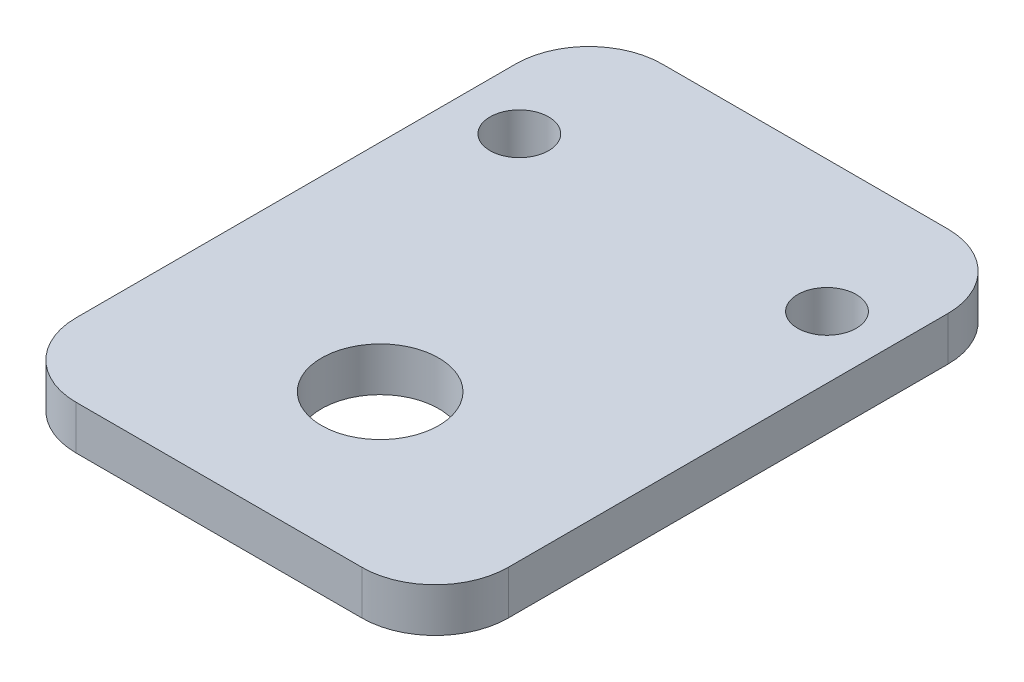
from build123d import *

# Parameters (mm, degrees)
ESQUISSE1_W             = 29.5
ESQUISSE1_H             = 3
EXTRU_MINCE1_DEPTH      = 40
ESQUISSE2_R             = 2
ESQUISSE2_R_2           = 4
ENL_V_MAT_EXTRU_1_DEPTH = 50.792067641
CONG_1_R                = 5


with BuildPart() as part:
    # Esquisse1 → Extru.-Mince1 (new body)
    with BuildSketch(Plane.XY):
        with Locations((14.75, 1.5)):
            Rectangle(ESQUISSE1_W, ESQUISSE1_H)
    extrude(amount=EXTRU_MINCE1_DEPTH)

    # Esquisse2 → Enlèv. mat.-Extru.1 (cut, through all)
    with BuildSketch(Plane(origin=(0, 3, 0), x_dir=(1, 0, 0), z_dir=(0, 1, 0))):
        with Locations((4.25, -9)):
            Circle(ESQUISSE2_R)
        with Locations((25.25, -9)):
            Circle(ESQUISSE2_R)
        with Locations((14.75, -29)):
            Circle(ESQUISSE2_R_2)
    extrude(amount=-ENL_V_MAT_EXTRU_1_DEPTH, mode=Mode.SUBTRACT)

    # Congé1
    cong_1_edges = [part.edges().sort_by_distance(p)[0] for p in [
        (29.5, 1.5, 0),
        (0, 1.5, 40),
        (0, 1.5, 0),
        (29.5, 1.5, 40),
    ]]
    fillet(cong_1_edges, radius=CONG_1_R)


solid = part.part
